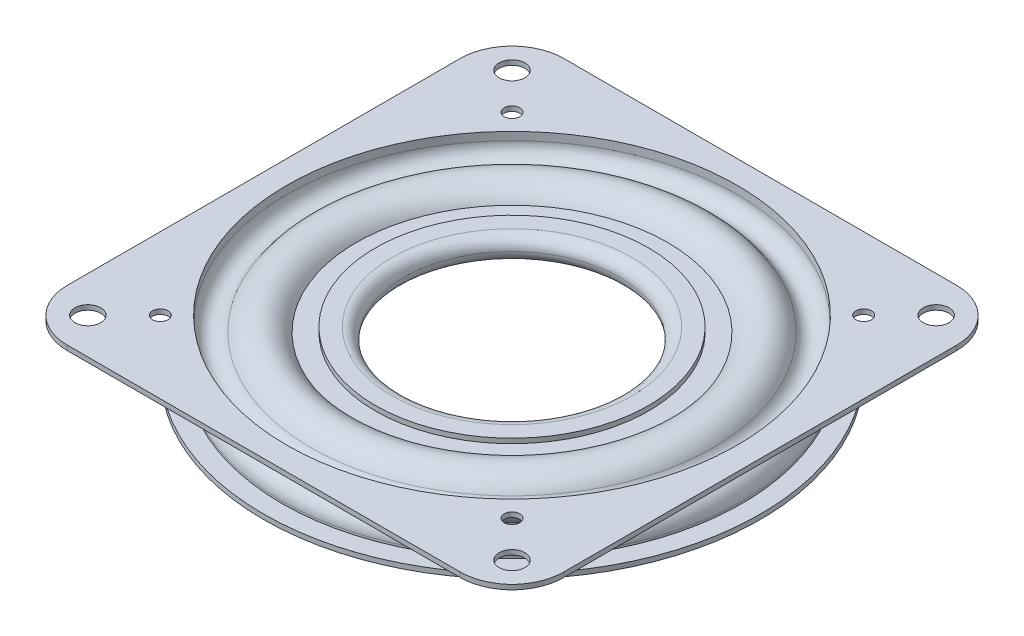
from build123d import *

# Parameters (mm, degrees)
SKETCH2_R                                 = 34.557781481
EXTRUDE1_DEPTH                            = 0.7366
EXTRUDE2_START                            = -0.7366
SKETCH3_W                                 = 76.2
SKETCH3_H                                 = 76.2
SKETCH3_R                                 = 34.557781481
EXTRUDE2_DEPTH                            = 0.7366
CIRPATTERN1_COUNT                         = 3
FILLET1_R                                 = 7.9502
FILLET2_R                                 = 7.9502
SKETCH5_W                                 = 1.984375
SKETCH5_H                                 = 0.7366
F_5_32_0_156250_DIAMETER_HOLE1_AT_2_COUNT = 2
F_5_32_0_156250_DIAMETER_HOLE1_AT_2_PITCH = 65.1002
F_5_32_0_156250_DIAMETER_HOLE1_AT_3_COUNT = 2
F_5_32_0_156250_DIAMETER_HOLE1_AT_3_PITCH = 65.1002
F_5_32_0_156250_DIAMETER_HOLE1_AT_4_COUNT = 2
F_5_32_0_156250_DIAMETER_HOLE1_AT_4_PITCH = 92.065585753
SKETCH7_W                                 = 1.984375
SKETCH7_H                                 = 8.128
F_5_32_0_156250_DIAMETER_HOLE2_AT_2_COUNT = 2
F_5_32_0_156250_DIAMETER_HOLE2_AT_2_PITCH = 65.1002
F_5_32_0_156250_DIAMETER_HOLE2_AT_3_COUNT = 2
F_5_32_0_156250_DIAMETER_HOLE2_AT_3_PITCH = 92.065585753
F_5_32_0_156250_DIAMETER_HOLE2_AT_4_COUNT = 2
F_5_32_0_156250_DIAMETER_HOLE2_AT_4_PITCH = 65.1002
F_3_32_0_09375_DIAMETER_HOLE1_AT_2_COUNT  = 2
F_3_32_0_09375_DIAMETER_HOLE1_AT_2_PITCH  = 53.975
F_3_32_0_09375_DIAMETER_HOLE1_AT_3_COUNT  = 2
F_3_32_0_09375_DIAMETER_HOLE1_AT_3_PITCH  = 76.332177029
F_3_32_0_09375_DIAMETER_HOLE1_AT_4_COUNT  = 2
F_3_32_0_09375_DIAMETER_HOLE1_AT_4_PITCH  = 53.975
SKETCH11_R                                = 51.664614741
SKETCH11_R_2                              = 38.1
CUT_EXTRUDE1_DEPTH                        = 1


# Read off the part's stored shape, not the designer's step: Revolve-Thin5
with BuildPart() as part:
    # Sketch1 → Revolve-Thin4 (revolve)
    with BuildSketch(Plane.XY, mode=Mode.PRIVATE) as revolve_thin4_sk:
        with BuildLine():
            Line((20.959011942, 1.778), (18.415, 1.778))
            ThreePointArc((18.415, 1.778), (16.637, 0), (18.415, -1.778))
            Line((18.415, -1.778), (23.503023884, -1.778))
            ThreePointArc((23.503023884, -1.778), (26.822976031, -4.788389506), (30.836320987, -2.794))
            ThreePointArc((30.836320987, -2.794), (33.072287853, -1.842454994), (34.557781481, -3.76555))
            Line((34.557781481, -3.76555), (34.557781481, -4.826))
            Line((34.557781481, -4.826), (38.1, -4.826))
            Line((38.1, -4.826), (38.1, -4.0894))
            Line((38.1, -4.0894), (35.294381481, -4.0894))
            Line((35.294381481, -4.0894), (35.294381481, -3.76555))
            ThreePointArc((35.294381481, -3.76555), (33.258353473, -1.129742468), (30.193721571, -2.433936741))
            ThreePointArc((30.193721571, -2.433936741), (26.643008112, -4.007091339), (24.135607796, -1.0414))
            Line((24.135607796, -1.0414), (18.415, -1.0414))
            ThreePointArc((18.415, -1.0414), (17.3736, 0), (18.415, 1.0414))
            Line((18.415, 1.0414), (20.959011942, 1.0414))
            Line((20.959011942, 1.0414), (20.959011942, 1.778))
        make_face()
    revolve(revolve_thin4_sk.sketch.rotate(Axis((0, 21.71272626, 0), (0, -1, 0)), 90), axis=Axis((0, 21.71272626, 0), (0, -1, 0)))

    # Sketch2 → Extrude1 (add)
    with BuildSketch(Plane.XZ.offset(4.826)):
        Polygon((53.881536726, 0), (0, -53.881536726), (-53.881536726, 0), (0, 53.881536726), align=None)
        with Locations(Location((0, 0, 0), (0, 0, 90))):
            Circle(SKETCH2_R, mode=Mode.SUBTRACT)
    extrude(amount=-EXTRUDE1_DEPTH)

    # Fillet2
    fillet2_edges = [part.edges().sort_by_distance(p)[0] for p in [
        (0, -4.4577, -53.881536726),
        (-53.881536726, -4.4577, 0),
        (0, -4.4577, 53.881536726),
        (53.881536726, -4.4577, 0),
    ]]
    fillet(fillet2_edges, radius=FILLET2_R)

    # Sketch5 → 5/32 (0.156250) Diameter Hole1 (revolve, cut)
    with BuildSketch(Plane(origin=(0, -4.0894, -46.032792877), x_dir=(0, 0, 1), z_dir=(1, 0, 0))):
        with Locations((0.9921875, 0.3683)):
            Rectangle(SKETCH5_W, SKETCH5_H)
    f_5_32_0_156250_diameter_hole1 = revolve(axis=Axis((0, 2.2606, -46.032792877), (0, -1, 0)), mode=Mode.SUBTRACT)

    # 5/32 (0.156250) Diameter Hole1 at 2: 5/32 (0.156250) Diameter Hole1 ×2
    with Locations(*[Vector(0.7071067811865476, 0, 0.7071067811865475) * (i * F_5_32_0_156250_DIAMETER_HOLE1_AT_2_PITCH) for i in range(1, F_5_32_0_156250_DIAMETER_HOLE1_AT_2_COUNT)]):
        add(f_5_32_0_156250_diameter_hole1, mode=Mode.SUBTRACT)

    # 5/32 (0.156250) Diameter Hole1 at 3: 5/32 (0.156250) Diameter Hole1 ×2
    with Locations(*[Vector(-0.7071067811865475, 0, 0.7071067811865477) * (i * F_5_32_0_156250_DIAMETER_HOLE1_AT_3_PITCH) for i in range(1, F_5_32_0_156250_DIAMETER_HOLE1_AT_3_COUNT)]):
        add(f_5_32_0_156250_diameter_hole1, mode=Mode.SUBTRACT)

    # 5/32 (0.156250) Diameter Hole1 at 4: 5/32 (0.156250) Diameter Hole1 ×2
    with Locations(*[(0, 0, i * F_5_32_0_156250_DIAMETER_HOLE1_AT_4_PITCH) for i in range(1, F_5_32_0_156250_DIAMETER_HOLE1_AT_4_COUNT)]):
        add(f_5_32_0_156250_diameter_hole1, mode=Mode.SUBTRACT)

    # Sketch11 → Cut-Extrude1 (cut)
    with BuildSketch(Plane.XZ.offset(4.826)):
        Circle(SKETCH11_R)
        with Locations(Location((0, 0, 0), (0, 0, 270))):
            Circle(SKETCH11_R_2, mode=Mode.SUBTRACT)
    extrude(amount=-CUT_EXTRUDE1_DEPTH, mode=Mode.SUBTRACT)


with BuildPart() as body_2:
    # Revolve-Thin5 outline → Revolve-Thin5 (revolve)
    with BuildSketch(Plane.XY):
        with BuildLine():
            Line((38.1, 3.302), (34.557781481, 3.302))
            Line((34.557781481, 3.302), (34.557781481, 2.06375))
            ThreePointArc((34.557781481, 2.06375), (33.072287853, 0.140654994), (30.836320987, 1.0922))
            ThreePointArc((30.836320987, 1.0922), (27.339502199, 3.124094231), (23.872699559, 1.0414))
            Line((23.872699559, 1.0414), (18.415, 1.0414))
            Line((18.415, 1.0414), (18.415, 0.3048))
            Line((18.415, 0.3048), (24.343233109, 0.3048))
            ThreePointArc((24.343233109, 0.3048), (27.132579028, 2.378995284), (30.193721571, 0.732136741))
            ThreePointArc((30.193721571, 0.732136741), (33.258353473, -0.572057532), (35.294381481, 2.06375))
            Line((35.294381481, 2.06375), (35.294381481, 2.5654))
            Line((35.294381481, 2.5654), (38.1, 2.5654))
            Line((38.1, 2.5654), (38.1, 3.302))
        make_face()
    revolve(axis=Axis((0, 0, 0), (0, 1, 0)))

    # Sketch3 → Extrude2 (add)
    with BuildSketch(Plane(origin=(0, 3.302, 0), x_dir=(-1, 0, 0), z_dir=(0, 1, 0)).offset(EXTRUDE2_START)):
        Rectangle(SKETCH3_W, SKETCH3_H)
        with Locations(Location((0, 0, 0), (0, 0, 90))):
            Circle(SKETCH3_R, mode=Mode.SUBTRACT)
    extrude(amount=EXTRUDE2_DEPTH)

    # Fillet1
    fillet1_edges = [body_2.edges().sort_by_distance(p)[0] for p in [
        (-38.1, 2.9337, -38.1),
        (-38.1, 2.9337, 38.1),
        (38.1, 2.9337, 38.1),
        (38.1, 2.9337, -38.1),
    ]]
    fillet(fillet1_edges, radius=FILLET1_R)

    # Sketch7 → 5/32 (0.156250) Diameter Hole2 (revolve, cut)
    with BuildSketch(Plane(origin=(32.5501, 3.302, -32.5501), x_dir=(0, 0, 1), z_dir=(1, 0, 0))):
        with Locations((0.9921875, 4.064)):
            Rectangle(SKETCH7_W, SKETCH7_H)
    f_5_32_0_156250_diameter_hole2 = revolve(axis=Axis((32.5501, 9.652, -32.5501), (0, -1, 0)), mode=Mode.SUBTRACT)

    # 5/32 (0.156250) Diameter Hole2 at 2: 5/32 (0.156250) Diameter Hole2 ×2
    with Locations(*[(-i * F_5_32_0_156250_DIAMETER_HOLE2_AT_2_PITCH, 0, 0) for i in range(1, F_5_32_0_156250_DIAMETER_HOLE2_AT_2_COUNT)]):
        add(f_5_32_0_156250_diameter_hole2, mode=Mode.SUBTRACT)

    # 5/32 (0.156250) Diameter Hole2 at 3: 5/32 (0.156250) Diameter Hole2 ×2
    with Locations(*[Vector(-0.7071067811865476, 0, 0.7071067811865476) * (i * F_5_32_0_156250_DIAMETER_HOLE2_AT_3_PITCH) for i in range(1, F_5_32_0_156250_DIAMETER_HOLE2_AT_3_COUNT)]):
        add(f_5_32_0_156250_diameter_hole2, mode=Mode.SUBTRACT)

    # 5/32 (0.156250) Diameter Hole2 at 4: 5/32 (0.156250) Diameter Hole2 ×2
    with Locations(*[(0, 0, i * F_5_32_0_156250_DIAMETER_HOLE2_AT_4_PITCH) for i in range(1, F_5_32_0_156250_DIAMETER_HOLE2_AT_4_COUNT)]):
        add(f_5_32_0_156250_diameter_hole2, mode=Mode.SUBTRACT)

    # Sketch9 → 3/32 (0.09375) Diameter Hole1 (revolve, cut)
    with BuildSketch(Plane(origin=(-26.9875, 3.302, -26.9875), x_dir=(0, 0, 1), z_dir=(1, 0, 0))):
        Polygon((0, 0), (0, 3.890781221), (1.19126, 3.175), (1.19126, 0), align=None)
    f_3_32_0_09375_diameter_hole1 = revolve(axis=Axis((-26.9875, 9.652, -26.9875), (0, -1, 0)), mode=Mode.SUBTRACT)

    # 3/32 (0.09375) Diameter Hole1 at 2: 3/32 (0.09375) Diameter Hole1 ×2
    with Locations(*[(i * F_3_32_0_09375_DIAMETER_HOLE1_AT_2_PITCH, 0, 0) for i in range(1, F_3_32_0_09375_DIAMETER_HOLE1_AT_2_COUNT)]):
        add(f_3_32_0_09375_diameter_hole1, mode=Mode.SUBTRACT)

    # 3/32 (0.09375) Diameter Hole1 at 3: 3/32 (0.09375) Diameter Hole1 ×2
    with Locations(*[Vector(0.7071067811865476, 0, 0.7071067811865476) * (i * F_3_32_0_09375_DIAMETER_HOLE1_AT_3_PITCH) for i in range(1, F_3_32_0_09375_DIAMETER_HOLE1_AT_3_COUNT)]):
        add(f_3_32_0_09375_diameter_hole1, mode=Mode.SUBTRACT)

    # 3/32 (0.09375) Diameter Hole1 at 4: 3/32 (0.09375) Diameter Hole1 ×2
    with Locations(*[(0, 0, i * F_3_32_0_09375_DIAMETER_HOLE1_AT_4_PITCH) for i in range(1, F_3_32_0_09375_DIAMETER_HOLE1_AT_4_COUNT)]):
        add(f_3_32_0_09375_diameter_hole1, mode=Mode.SUBTRACT)


with BuildPart() as body_3:
    # Sketch4 → Revolve1 (revolve)
    with BuildSketch(Plane.XY):
        with BuildLine():
            Line((27.3685, 2.5146), (27.3685, -4.2164))
            ThreePointArc((27.3685, -4.2164), (30.734, -0.8509), (27.3685, 2.5146))
        make_face()
    revolve(axis=Axis((27.3685, 2.837450101, 0), (0, -1, 0)))


with BuildPart() as cirpattern1_1:
    # CirPattern1: pattern copy
    add(body_3.part.rotate(Axis((0, 0, 0), (0, 1, 0)), 1 * 360 / CIRPATTERN1_COUNT))


with BuildPart() as cirpattern1_2:
    # CirPattern1: pattern copy
    add(body_3.part.rotate(Axis((0, 0, 0), (0, 1, 0)), 2 * 360 / CIRPATTERN1_COUNT))


solid = Compound([part.part, body_2.part, body_3.part, cirpattern1_1.part, cirpattern1_2.part])
